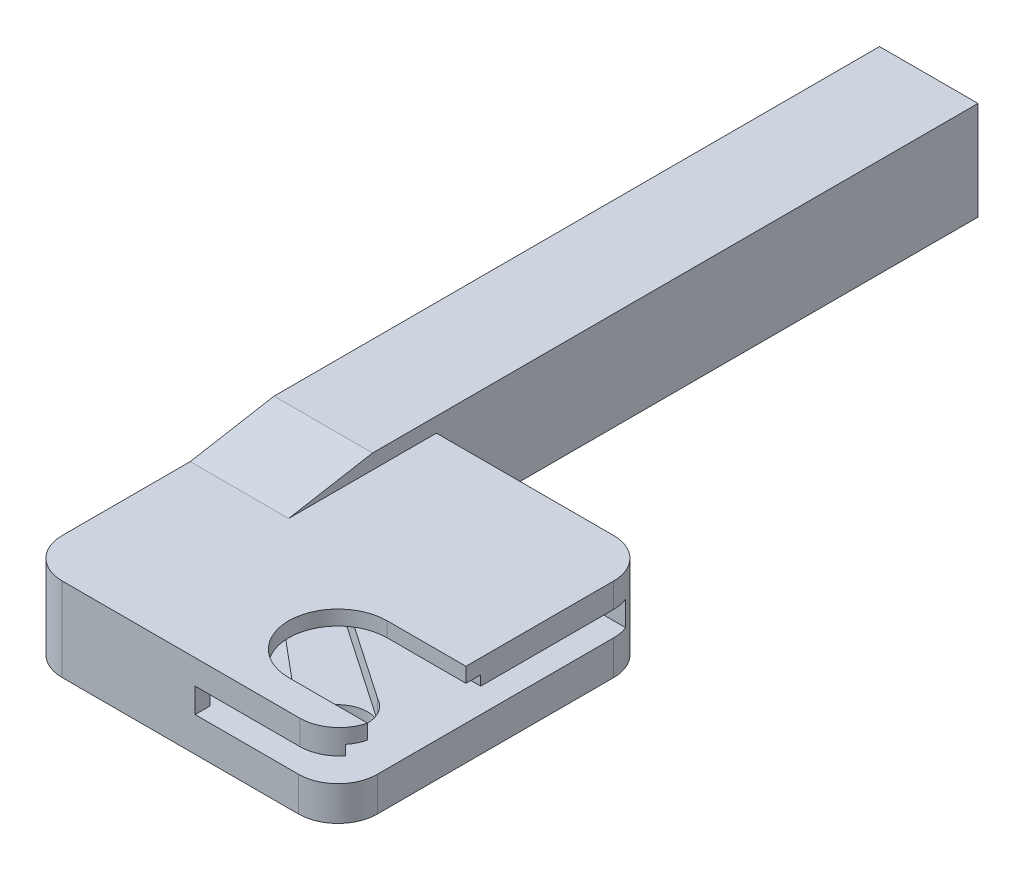
from build123d import *

# Parameters (mm, degrees)
BLOCK_DEPTH                    = 6.5
BLOCK_DEPTH_BACK               = 2
SKETCH1_W                      = 32
SKETCH1_H                      = 32
SKETCH2_R                      = 3
CENTER_HOLE_DEPTH              = 35.989284074
SKETCH4_W                      = 13
SKETCH4_H                      = 3.5
THICK_INSIDE_CUT_OUT_DEPTH     = 30.5
SKETCH5_W                      = 15
SKETCH5_H                      = 2.5
THIN_CUTOUT_DEPTH              = 14.5
THICK_INSIDE_ROUNDING_R        = 6
THIN_INSIDE_ROUNDING_R         = 6
SKETCH6_W                      = 19.345400155
SKETCH6_H                      = 2.5
TEMP_BOTTM_THIN_CUT_OUT_DEPTH  = 14.5
SPLINE_HOLE_REACH              = 36.989
POLE_DEPTH                     = 1.5
POLE_DEPTH_BACK                = 8.5
SKETCH8_W                      = 10
SKETCH8_H                      = 70
SKETCH10_R                     = 2.5
POLE_HOLE_DEPTH                = 65
CHAMFER3_SIZE2                 = 8.506922729
CHAMFER3_SIZE                  = 1.5
SKETCH11_R                     = 0.6
INSIDE_RETAINER_PINS_DEPTH     = 0.5
RETAINER_PIN_CONING_SIZE       = 0.5
WIRE_CHANNEL_DEPTH             = 4
WIRE_CHANNEL_INSIDE_ROUND_SIZE = 1
LOW_START                      = -3
LOW_EDGE_ROUNDING_DEPTH        = 10
LOW_EDGE_ROUNDING_2_DEPTH      = 7
SKETCH13_W                     = 10
SKETCH13_H                     = 8
TOP_NOTCH_DEPTH                = 7


with BuildPart() as part:
    # Sketch1 → Block (new, two sides: drawn at the far end of the back side and taken through both)
    with BuildSketch(Plane(origin=(0, 0, 0), x_dir=(1, 0, 0), z_dir=(0, 1, 0)).offset(-BLOCK_DEPTH_BACK)):
        with Locations((-8, 8)):
            Rectangle(SKETCH1_W, SKETCH1_H)
    extrude(amount=BLOCK_DEPTH + BLOCK_DEPTH_BACK)

    # Sketch2 → Center Hole (cut, through all)
    with BuildSketch(Plane(origin=(0, 6.5, 0), x_dir=(1, 0, 0), z_dir=(0, 1, 0))):
        with Locations(Location((0, 0, 0), (0, 0, 270))):
            Circle(SKETCH2_R)
    extrude(amount=-CENTER_HOLE_DEPTH, mode=Mode.SUBTRACT)

    # Sketch4 → Thick inside cut-out (cut)
    with BuildSketch(Plane(origin=(8, 0, -8), x_dir=(0, 0, 1), z_dir=(-1, 0, 0))):
        with Locations((8, 3.25)):
            Rectangle(SKETCH4_W, SKETCH4_H)
    extrude(amount=THICK_INSIDE_CUT_OUT_DEPTH, mode=Mode.SUBTRACT)

    # Sketch5 → Thin Cutout (cut)
    with BuildSketch(Plane(origin=(8, 0, 0), x_dir=(0, 0, -1), z_dir=(1, 0, 0))):
        with Locations((14, 2.75)):
            Rectangle(SKETCH5_W, SKETCH5_H)
    extrude(amount=-THIN_CUTOUT_DEPTH, mode=Mode.SUBTRACT)

    # Thick inside rounding
    thick_inside_rounding_edges = [part.edges().sort_by_distance(p)[0] for p in [
        (-22.5, 3.25, 6.5),
        (-22.5, 3.25, -6.5),
    ]]
    fillet(thick_inside_rounding_edges, radius=THICK_INSIDE_ROUNDING_R)

    # Thin inside rounding
    thin_inside_rounding_edges = [part.edges().sort_by_distance(p)[0] for p in [
        (-6.5, 2.75, -21.5),
    ]]
    fillet(thin_inside_rounding_edges, radius=THIN_INSIDE_ROUNDING_R)

    # Sketch6 → TEMP Bottm Thin cut-out (cut)
    with BuildSketch(Plane(origin=(8, 0, 0), x_dir=(0, 0, -1), z_dir=(1, 0, 0))):
        with Locations((-3.172700078, 2.75)):
            Rectangle(SKETCH6_W, SKETCH6_H)
    extrude(amount=-TEMP_BOTTM_THIN_CUT_OUT_DEPTH, mode=Mode.SUBTRACT)

    # Sketch7 → Spline Hole (cut, up to next)
    with BuildSketch(Plane(origin=(0, 6.5, 0), x_dir=(1, 0, 0), z_dir=(0, 1, 0)), mode=Mode.PRIVATE) as spline_hole_sk1:
        with BuildLine():
            Line((0, 5), (8, 5))
            Line((8, 5), (8, -5))
            Line((8, -5), (0, -5))
            ThreePointArc((0, -5), (-5, 0), (0, 5))
        make_face()
    spline_hole_tool1 = extrude(spline_hole_sk1.sketch, amount=-SPLINE_HOLE_REACH, mode=Mode.PRIVATE) & part.part
    add(spline_hole_tool1.solids().sort_by_distance((1.984295, 6.5, 0))[0], mode=Mode.SUBTRACT)

    # Sketch8 → Pole (add, two sides: drawn at the far end of the back side and taken through both)
    with BuildSketch(Plane(origin=(0, 6.5, 0), x_dir=(1, 0, 0), z_dir=(0, 1, 0)).offset(-POLE_DEPTH_BACK)):
        with Locations((-19, 44)):
            Rectangle(SKETCH8_W, SKETCH8_H)
    extrude(amount=POLE_DEPTH + POLE_DEPTH_BACK)

    # Sketch10 → Pole Hole (cut)
    with BuildSketch(Plane(origin=(0, 0, -79), x_dir=(-1, 0, 0), z_dir=(0, 0, -1))):
        with Locations((19, 3)):
            Circle(SKETCH10_R)
    extrude(amount=-POLE_HOLE_DEPTH, mode=Mode.SUBTRACT)

    # Chamfer3
    chamfer3_edges = [part.edges().sort_by_distance(p)[0] for p in [
        (-19, 8, -9),
    ]]
    chamfer3_side = [part.faces().sort_by_distance(p)[0] for p in [
        (-19, 7.97, -9),
    ]]
    chamfer(chamfer3_edges, length=CHAMFER3_SIZE - 0.0001, length2=CHAMFER3_SIZE2 - 0.0001, reference=chamfer3_side[0])  # a hair under: the kernel refuses the full size

    # Sketch11 → Inside Retainer Pins (add)
    with BuildSketch(Plane(origin=(0, 1.5, 0), x_dir=(1, 0, 0), z_dir=(0, 1, 0))):
        with Locations(Location((-13.2, 0, 0), (0, 0, 270))):
            Circle(SKETCH11_R)
        with Locations(Location((-16.1, 0, 0), (0, 0, 270))):
            Circle(SKETCH11_R)
        with Locations(Location((-19, 0, 0), (0, 0, 270))):
            Circle(SKETCH11_R)
        with Locations(Location((-10.3, 0, 0), (0, 0, 270))):
            Circle(SKETCH11_R)
    extrude(amount=INSIDE_RETAINER_PINS_DEPTH)

    # Retainer Pin Coning
    # a fillet whose section is not a circle: 0.5 mm, written as the material it takes off along each edge
    with BuildSketch(Plane(origin=(-13.2, 2, 0), x_dir=(0, 0, 1), z_dir=(-1, 0, 0))) as retainer_pin_coning_piece_1:
        with BuildLine():
            Bezier((0.6, -RETAINER_PIN_CONING_SIZE), (0.6, 0), (0.6 - RETAINER_PIN_CONING_SIZE, 0), weights=[1, 0.052631579, 1])
            Line((0.6 - RETAINER_PIN_CONING_SIZE, 0), (0.6, 0))
            Line((0.6, 0), (0.6, -RETAINER_PIN_CONING_SIZE))
        make_face()
    revolve(axis=Axis((-13.2, 2, 0), (0, 1, 0)), mode=Mode.SUBTRACT)
    with BuildSketch(Plane(origin=(-16.1, 2, 0), x_dir=(0, 0, 1), z_dir=(-1, 0, 0))) as retainer_pin_coning_piece_2:
        with BuildLine():
            Bezier((0.6, -RETAINER_PIN_CONING_SIZE), (0.6, 0), (0.6 - RETAINER_PIN_CONING_SIZE, 0), weights=[1, 0.052631579, 1])
            Line((0.6 - RETAINER_PIN_CONING_SIZE, 0), (0.6, 0))
            Line((0.6, 0), (0.6, -RETAINER_PIN_CONING_SIZE))
        make_face()
    revolve(axis=Axis((-16.1, 2, 0), (0, 1, 0)), mode=Mode.SUBTRACT)
    with BuildSketch(Plane(origin=(-19, 2, 0), x_dir=(0, 0, 1), z_dir=(-1, 0, 0))) as retainer_pin_coning_piece_3:
        with BuildLine():
            Bezier((0.6, -RETAINER_PIN_CONING_SIZE), (0.6, 0), (0.6 - RETAINER_PIN_CONING_SIZE, 0), weights=[1, 0.052631579, 1])
            Line((0.6 - RETAINER_PIN_CONING_SIZE, 0), (0.6, 0))
            Line((0.6, 0), (0.6, -RETAINER_PIN_CONING_SIZE))
        make_face()
    revolve(axis=Axis((-19, 2, 0), (0, 1, 0)), mode=Mode.SUBTRACT)
    with BuildSketch(Plane(origin=(-10.3, 2, 0), x_dir=(0, 0, 1), z_dir=(-1, 0, 0))) as retainer_pin_coning_piece_4:
        with BuildLine():
            Bezier((0.6, -RETAINER_PIN_CONING_SIZE), (0.6, 0), (0.6 - RETAINER_PIN_CONING_SIZE, 0), weights=[1, 0.052631579, 1])
            Line((0.6 - RETAINER_PIN_CONING_SIZE, 0), (0.6, 0))
            Line((0.6, 0), (0.6, -RETAINER_PIN_CONING_SIZE))
        make_face()
    revolve(axis=Axis((-10.3, 2, 0), (0, 1, 0)), mode=Mode.SUBTRACT)

    # Sketch12 → Wire Channel (cut)
    with BuildSketch(Plane.XZ.offset(0.5)):
        Polygon((-22.113006715, -14.596503849), (-2.000674011, 2.235464941), (2.000674011, -2.235464941), (-16.054382345, -14.596503849), align=None)
    extrude(amount=-WIRE_CHANNEL_DEPTH, mode=Mode.SUBTRACT)

    # Wire Channel Inside Round
    # a fillet whose section is not a circle: 1 mm, written as the material it takes off along each edge
    with BuildSketch(Plane(origin=(-23.900250886, 3.5, -14), x_dir=(0, 0, 1), z_dir=(1, 0, 0))) as wire_channel_inside_round_piece_1_section:
        with BuildLine():
            Bezier((WIRE_CHANNEL_INSIDE_ROUND_SIZE, 0), (0, 0), (0, -WIRE_CHANNEL_INSIDE_ROUND_SIZE), weights=[1, 0.052631579, 1])
            Line((0, -WIRE_CHANNEL_INSIDE_ROUND_SIZE), (0, 0))
            Line((0, 0), (WIRE_CHANNEL_INSIDE_ROUND_SIZE, 0))
        make_face()
    wire_channel_inside_round_piece_1 = extrude(amount=9.849740629, mode=Mode.PRIVATE)
    wire_channel_inside_round_piece_1 = wire_channel_inside_round_piece_1 & Plane(origin=(-19, 3, -14), x_dir=(-1, 0, 0), z_dir=(0, 0, -1)) * Cylinder(2.5, 24, mode=Mode.PRIVATE)
    wire_channel_inside_round_piece_1 = split(wire_channel_inside_round_piece_1, bisect_by=Plane(origin=(-22.870494844, 3.5, -15.230444066), z_dir=(0.6417962422835523, 0, -0.7668752071821803)), keep=Keep.TOP, mode=Mode.PRIVATE)
    add(wire_channel_inside_round_piece_1, mode=Mode.SUBTRACT)

    # Low Edge Rounding: read off the stored shape, not the designer's step
    # Low Edge Rounding outline → Low Edge Rounding (cut)
    with BuildSketch(Plane(origin=(0, 0, 0), x_dir=(1, 0, 0), z_dir=(0, 1, 0)).offset(LOW_START)):
        with BuildLine():
            Line((-24, -8), (-20, -8))
            ThreePointArc((-20, -8), (-22.828427125, -6.828427125), (-24, -4))
            Line((-24, -4), (-24, -8))
        make_face()
        with BuildLine():
            Line((8, 20), (8, 24))
            Line((8, 24), (4, 24))
            ThreePointArc((4, 24), (6.828427125, 22.828427125), (8, 20))
        make_face()
        with BuildLine():
            ThreePointArc((8, -5), (6.576506397, -7.16227766), (4.127016654, -8))
            Line((4.127016654, -8), (8, -8))
            Line((8, -8), (8, -5))
        make_face()
    extrude(amount=LOW_EDGE_ROUNDING_DEPTH, mode=Mode.SUBTRACT)

    # Low Edge Rounding 2 outline → Low Edge Rounding 2 (cut)
    with BuildSketch(Plane(origin=(0, 0, 0), x_dir=(1, 0, 0), z_dir=(0, 1, 0)).offset(LOW_START)):
        with BuildLine():
            Line((8, -5), (8, -4))
            ThreePointArc((8, -4), (6.828427125, -6.828427125), (4, -8))
            Line((4, -8), (4.127016654, -8))
            ThreePointArc((4.127016654, -8), (6.576506397, -7.16227766), (8, -5))
        make_face()
    extrude(amount=LOW_EDGE_ROUNDING_2_DEPTH, mode=Mode.SUBTRACT)

    # Sketch13 → Top Notch (cut)
    with BuildSketch(Plane.ZY.offset(24)):
        with Locations((-74.058881993, 3)):
            Rectangle(SKETCH13_W, SKETCH13_H)
    extrude(amount=-TOP_NOTCH_DEPTH, mode=Mode.SUBTRACT)


solid = part.part
